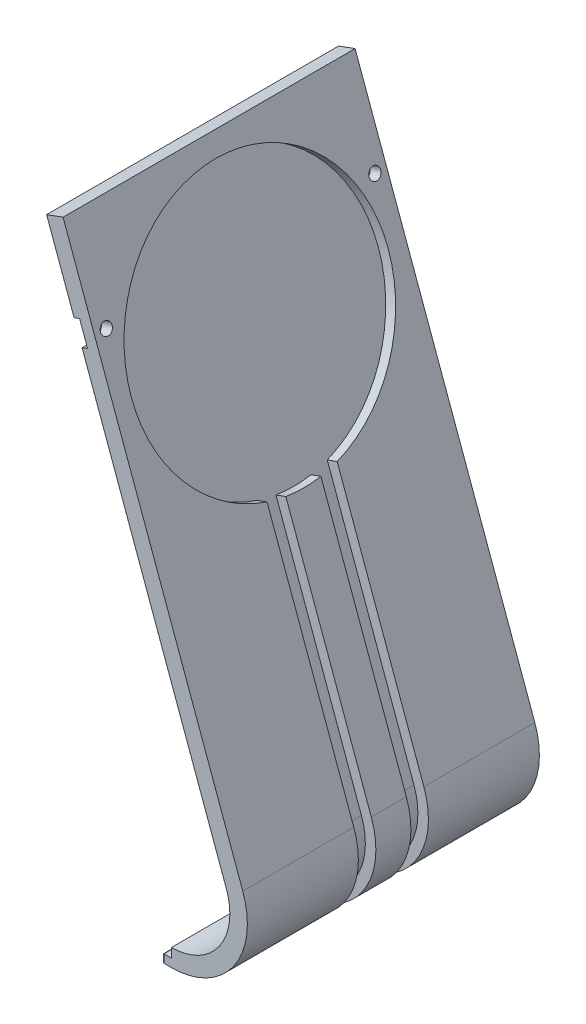
from build123d import *

# Parameters (mm, degrees)
EXTRUDE_1_DEPTH        = 25
SKETCH_4_R             = 22
CUT_EXTRUDE_1_DEPTH    = 1.8
CUT_EXTRUDE_START      = 6
CUT_EXTRUDE_1_2_DEPTH  = 3
SKETCH_11_W            = 18.9
SKETCH_11_H            = 1.4
EXTRUDE_3_DEPTH        = 1.5
FILLET_1_R             = 0.25
SKETCH_12_R            = 1
CUT_EXTRUDE_2553_DEPTH = 101.256279435
CUT_EXTRUDE_1_3_DEPTH  = 1


with BuildPart() as part:
    # 草图2 → 整体拉伸-薄壁1 (new, symmetric)
    with BuildSketch(Plane.XY):
        with BuildLine():
            ThreePointArc((28.874192719, 7.049687275), (37.065713162, 11.313922912), (38.271118927, 20.469888708))
            Line((38.271118927, 20.469888708), (7.496652644, 105.022039918))
            Line((7.496652644, 105.022039918), (10.315730506, 106.048100348))
            Line((10.315730506, 106.048100348), (41.090196789, 21.495949138))
            ThreePointArc((41.090196789, 21.495949138), (39.523169295, 9.593193603), (28.874192719, 4.049687275))
            Line((28.874192719, 4.049687275), (28.874192719, 7.049687275))
        make_face()
    extrude(amount=EXTRUDE_1_DEPTH, both=True)

    # 草图4 → Cut-Extrude 1 (cut)
    with BuildSketch(Plane(origin=(43.192221736, 15.720683064, 0), x_dir=(0, 0, -1), z_dir=(0.9396926207859071, 0.3420201433256726, 0))):
        with Locations((0, 70.72442972)):
            Circle(SKETCH_4_R)
    extrude(amount=-CUT_EXTRUDE_1_DEPTH, mode=Mode.SUBTRACT)

    # 草图3 → Cut-Extrude 1 2 (cut)
    with BuildSketch(Plane.XY.offset(CUT_EXTRUDE_START)):
        with BuildLine():
            ThreePointArc((28.874192719, 5.849687275), (38.048695615, 10.625631188), (39.398750072, 20.88031288))
            Line((39.398750072, 20.88031288), (24.836038582, 60.891033865))
            Line((24.836038582, 60.891033865), (23.809978152, 63.710111727))
            Line((23.809978152, 63.710111727), (25.50142487, 64.325747985))
            Line((25.50142487, 64.325747985), (26.5274853, 61.506670123))
            Line((26.5274853, 61.506670123), (41.090196789, 21.495949138))
            ThreePointArc((41.090196789, 21.495949138), (39.523169295, 9.593193603), (28.874192719, 4.049687275))
            Line((28.874192719, 4.049687275), (28.874192719, 5.849687275))
        make_face()
    cut_extrude_1_2 = extrude(amount=-CUT_EXTRUDE_1_2_DEPTH, mode=Mode.SUBTRACT)

    # 镜向1: Cut-Extrude 1 2 across plane
    add(cut_extrude_1_2.mirror(Plane.XY), mode=Mode.SUBTRACT)

    # 草图11 → 底部卡扣凸台-拉伸3 (add)
    with BuildSketch(Plane.ZY.offset(-28.874192719)):
        with Locations((-15.55, 4.749687275)):
            Rectangle(SKETCH_11_W, SKETCH_11_H)
        with Locations((15.55, 4.749687275)):
            Rectangle(SKETCH_11_W, SKETCH_11_H)
    extrude(amount=EXTRUDE_3_DEPTH)

    # 底部卡扣圆角1
    fillet_1_edges = [part.edges().sort_by_distance(p)[0] for p in [
        (27.374192719, 5.449687275, 15.55),
        (27.374192719, 4.749687275, 25),
        (27.374192719, 4.049687275, 15.55),
        (27.374192719, 4.749687275, 6.1),
        (27.374192719, 5.449687275, -15.55),
        (27.374192719, 4.749687275, -6.1),
        (27.374192719, 4.049687275, -15.55),
        (27.374192719, 4.749687275, -25),
    ]]
    fillet(fillet_1_edges, radius=FILLET_1_R)

    # 草图12 → Cut-Extrude 2553 (cut, through all)
    with BuildSketch(Plane(origin=(40.373143873, 14.694622634, 0), x_dir=(0, 0, 1), z_dir=(-0.9396926207859071, -0.3420201433256726, 0))):
        with Locations((23, 80.362226173)):
            Circle(SKETCH_12_R)
        with Locations((-23, 80.362226173)):
            Circle(SKETCH_12_R)
    extrude(amount=-CUT_EXTRUDE_2553_DEPTH, mode=Mode.SUBTRACT)

    # 草图13 → Cut-Extrude 1 3 (cut)
    with BuildSketch(Plane(origin=(40.373143873, 14.694622634, 0), x_dir=(0, 0, 1), z_dir=(-0.9396926207859071, -0.3420201433256726, 0))):
        with BuildLine():
            Line((23, 82.362226173), (25, 82.362226173))
            Line((25, 82.362226173), (25, 78.362226173))
            Line((25, 78.362226173), (23, 78.362226173))
            ThreePointArc((23, 78.362226173), (21, 80.362226173), (23, 82.362226173))
        make_face()
        with BuildLine():
            Line((-25, 82.362226173), (-25, 78.362226173))
            Line((-25, 78.362226173), (-23, 78.362226173))
            ThreePointArc((-23, 78.362226173), (-21, 80.362226173), (-23, 82.362226173))
            Line((-23, 82.362226173), (-25, 82.362226173))
        make_face()
    extrude(amount=-CUT_EXTRUDE_1_3_DEPTH, mode=Mode.SUBTRACT)


solid = part.part
